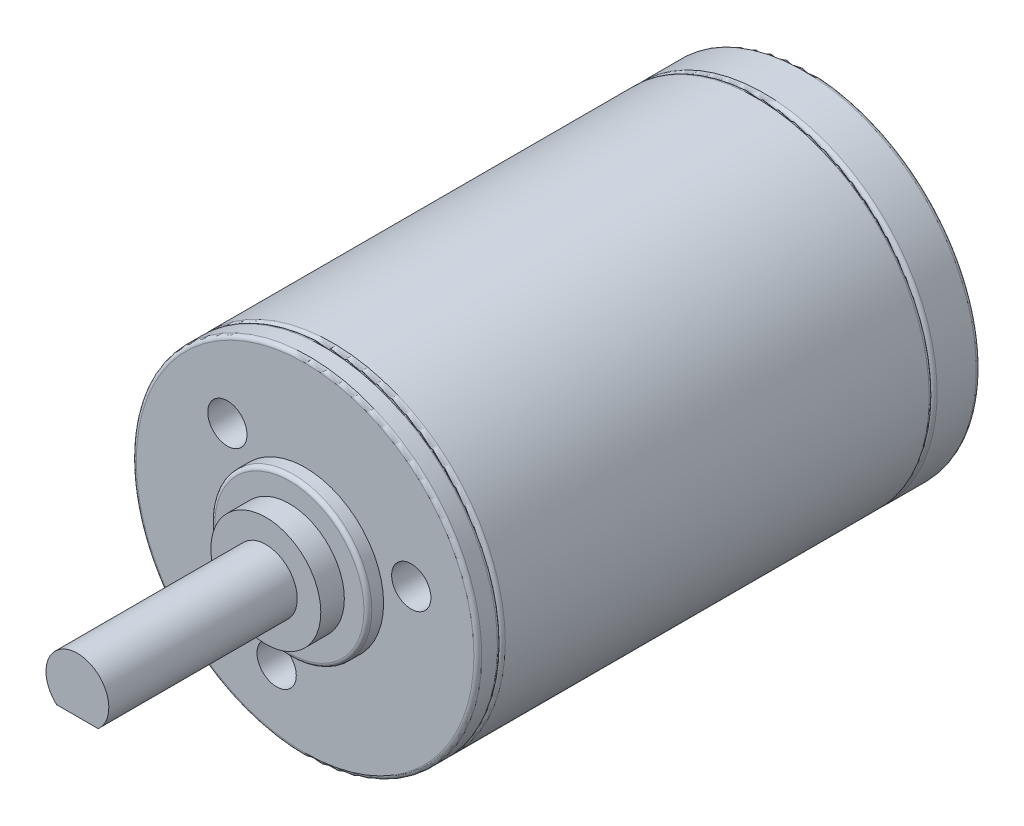
from build123d import *

# Parameters (mm, degrees)
ESQUISSE1_R             = 11
BOSS_EXTRU_1_DEPTH      = 27.5
CONG_1_R                = 0.25
BOSS_EXTRU_5_START      = 3
ESQUISSE4_R             = 11
BOSS_EXTRU_5_DEPTH      = 3
CONG_2_R                = 0.25
ESQUISSE5_R             = 11
BOSS_EXTRU_6_DEPTH      = 1.5
CONG_3_R                = 0.25
ESQUISSE6_R             = 5
BOSS_EXTRU_7_DEPTH      = 1
CONG_4_R                = 0.25
ESQUISSE7_R             = 3.5
BOSS_EXTRU_8_DEPTH      = 1.5
ESQUISSE8_R             = 2
BOSS_EXTRU_9_DEPTH      = 12
ENL_V_START             = -8.5
ENL_V_MAT_EXTRU_1_DEPTH = 8.5
ESQUISSE10_R            = 1.25
ENL_V_MAT_EXTRU_2_DEPTH = 3


with BuildPart() as part:
    # Esquisse1 → Boss.-Extru.1 (new body)
    with BuildSketch(Plane.XY):
        Circle(ESQUISSE1_R)
    extrude(amount=BOSS_EXTRU_1_DEPTH)

    # Congé1
    cong_1_edges = [part.edges().sort_by_distance(p)[0] for p in [
        (-11, 0, 0),
        (-11, 0, 27.5),
    ]]
    fillet(cong_1_edges, radius=CONG_1_R)

    # Esquisse4 → Boss.-Extru.5 (add)
    with BuildSketch(Plane(origin=(0, 0, 0), x_dir=(-1, 0, 0), z_dir=(0, 0, -1)).offset(BOSS_EXTRU_5_START)):
        with Locations(Location((0, 0, 0), (0, 0, 180))):
            Circle(ESQUISSE4_R)
    extrude(amount=-BOSS_EXTRU_5_DEPTH)

    # Congé2
    cong_2_edges = [part.edges().sort_by_distance(p)[0] for p in [
        (-11, 0, 0),
        (-11, 0, -3),
    ]]
    fillet(cong_2_edges, radius=CONG_2_R - 0.0001)  # a hair under: the kernel refuses the full size

    # Esquisse5 → Boss.-Extru.6 (add)
    with BuildSketch(Plane.XY.offset(27.5)):
        Circle(ESQUISSE5_R)
    extrude(amount=BOSS_EXTRU_6_DEPTH)

    # Congé3
    cong_3_edges = [part.edges().sort_by_distance(p)[0] for p in [
        (-11, 0, 27.5),
        (-11, 0, 29),
    ]]
    fillet(cong_3_edges, radius=CONG_3_R - 0.0001)  # a hair under: the kernel refuses the full size

    # Esquisse6 → Boss.-Extru.7 (add)
    with BuildSketch(Plane.XY.offset(29)):
        Circle(ESQUISSE6_R)
    extrude(amount=BOSS_EXTRU_7_DEPTH)

    # Congé4
    cong_4_edges = [part.edges().sort_by_distance(p)[0] for p in [
        (-5, 0, 30),
    ]]
    fillet(cong_4_edges, radius=CONG_4_R)

    # Esquisse7 → Boss.-Extru.8 (add)
    with BuildSketch(Plane.XY.offset(30)):
        Circle(ESQUISSE7_R)
    extrude(amount=BOSS_EXTRU_8_DEPTH)

    # Esquisse8 → Boss.-Extru.9 (add)
    with BuildSketch(Plane.XY.offset(31.5)):
        Circle(ESQUISSE8_R)
    extrude(amount=BOSS_EXTRU_9_DEPTH)

    # Esquisse9 → Enlèv. mat.-Extru.1 (cut)
    with BuildSketch(Plane.XY.offset(43.5).offset(ENL_V_START)):
        with BuildLine():
            Line((-1.322875656, -1.5), (1.322875656, -1.5))
            ThreePointArc((1.322875656, -1.5), (0, -2), (-1.322875656, -1.5))
        make_face()
    extrude(amount=ENL_V_MAT_EXTRU_1_DEPTH, mode=Mode.SUBTRACT)

    # Esquisse10 → Enlèv. mat.-Extru.2 (cut)
    with BuildSketch(Plane.XY.offset(29)):
        with Locations((6.761480784, 1.811733316)):
            Circle(ESQUISSE10_R)
        with Locations((-1.811733316, -6.761480784)):
            Circle(ESQUISSE10_R)
        with Locations((-4.949747468, 4.949747468)):
            Circle(ESQUISSE10_R)
    extrude(amount=-ENL_V_MAT_EXTRU_2_DEPTH, mode=Mode.SUBTRACT)


solid = part.part
